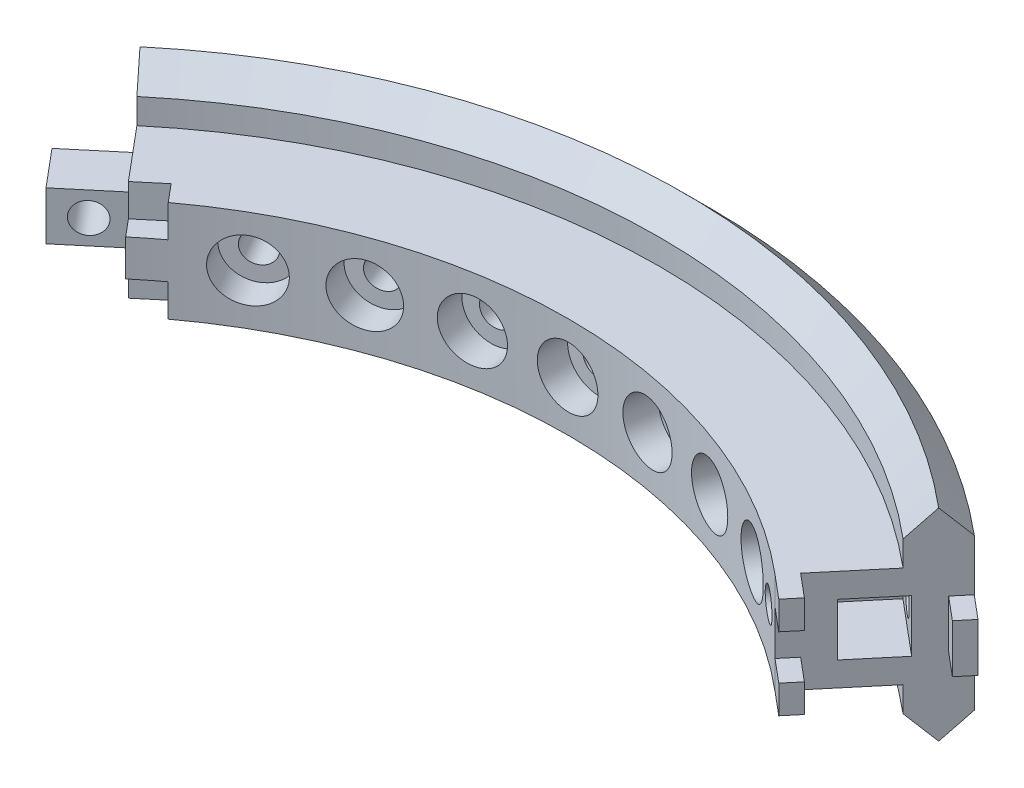
from build123d import *

# Parameters (mm, degrees)
REVOLVE_1_ANGLE          = 80
SKETCH_3_W               = 5.2
SKETCH_3_H               = 5.2
CUT_EXTRUDE_1_DEPTH      = 7
SKETCH_4_W               = 4.8
SKETCH_4_H               = 4.8
EXTRUDE_1_DEPTH          = 6
CUT_EXTRUDE_2_DEPTH      = 82.503774865
CUT_EXTRUDE_2_DEPTH_BACK = 82.503774865
SKETCH_5_R               = 1.5
CUT_EXTRUDE_START        = -1
SKETCH_6_R               = 3
CUT_EXTRUDE_3_DEPTH      = 83.736226881
SKETCH_7_R               = 1.5
CUT_EXTRUDE_4_DEPTH      = 83.059725381
SKETCH_11_R              = 1.5
CUT_EXTRUDE_6_DEPTH      = 52.064095038
CUT_EXTRUDE_7_DEPTH      = 5
SKETCH_13_W              = 3
SKETCH_13_H              = 3
PATTERN_CIRCULAR_1_COUNT = 4
PATTERN_CIRCULAR_1_ANGLE = 30
F_1_THE_OTHER_WAY_COUNT  = 4
F_1_THE_OTHER_WAY_ANGLE  = 30
SKETCH_9_W               = 1.8
SKETCH_9_H               = 4.8
SKETCH_9_H_2             = 2.8
EXTRUDE_2_DEPTH          = 3
SKETCH_10_W              = 2.2
SKETCH_10_H              = 5.2
CUT_EXTRUDE_5_DEPTH      = 3


# Read off the part's stored shape, not the designer's step: 旋转1
with BuildPart() as part:
    # 旋转1 outline → 旋转1 (revolve)
    with BuildSketch(Plane(origin=(0, 0, 0), x_dir=(0.6427876096865408, 0, -0.7660444431189768), z_dir=(0.7660444431189768, 0, 0.6427876096865408))):
        Polygon((59, 5), (50, 5), (50, -5), (59, -5), (59, -7.5), (61.5, -10), (64, -7.5), (64, 7.5), (61.5, 10), (59, 7.5), align=None)
    revolve(axis=Axis((0, 0, 0), (0, 1, 0)), revolution_arc=REVOLVE_1_ANGLE)

    # 草图3 → 切除-拉伸1 (cut)
    with BuildSketch(Plane(origin=(0, 0, 0), x_dir=(0.6427876096865405, 0, -0.766044443118977), z_dir=(0.7660444431189771, 0, 0.6427876096865406))):
        with Locations((57, 0)):
            Rectangle(SKETCH_3_W, SKETCH_3_H)
    extrude(amount=-CUT_EXTRUDE_1_DEPTH, mode=Mode.SUBTRACT)

    # 草图4 → 凸台-拉伸1 (add)
    with BuildSketch(Plane(origin=(0, 0, 0), x_dir=(0.6427876096865351, 0, 0.7660444431189817), z_dir=(-0.7660444431189817, 0, 0.6427876096865351))):
        with Locations((-57, 0)):
            Rectangle(SKETCH_4_W, SKETCH_4_H)
    extrude(amount=EXTRUDE_1_DEPTH)

    # 草图5 → 切除-拉伸2 (cut, two sides: drawn at the far end of the back side and taken through both)
    with BuildSketch(Plane(origin=(34.967645967, 0, -41.672817706), x_dir=(-0.7660444431189772, 0, -0.6427876096865404), z_dir=(0.6427876096865404, 0, -0.7660444431189772)).offset(-CUT_EXTRUDE_2_DEPTH_BACK)):
        with Locations((3.5, 0)):
            Circle(SKETCH_5_R)
    extrude(amount=CUT_EXTRUDE_2_DEPTH + CUT_EXTRUDE_2_DEPTH_BACK, mode=Mode.SUBTRACT)

    # 草图6 → 切除-拉伸3 (cut, through all)
    with BuildSketch(Plane(origin=(38.310141537, 0, -45.65624881), x_dir=(0.7660444431189772, 0, 0.6427876096865404), z_dir=(-0.6427876096865404, 0, 0.7660444431189772)).offset(CUT_EXTRUDE_START)):
        with Locations((-3.5, 0)):
            Circle(SKETCH_6_R)
    extrude(amount=-CUT_EXTRUDE_3_DEPTH, mode=Mode.SUBTRACT)

    # 草图7 → 切除-拉伸4 (cut, through all)
    with BuildSketch(Plane(origin=(-38.181584015, 0, -45.503039921), x_dir=(-0.7660444431189816, 0, 0.6427876096865353), z_dir=(-0.6427876096865353, 0, -0.7660444431189816))):
        with Locations((3, 0)):
            Circle(SKETCH_7_R)
    extrude(amount=-CUT_EXTRUDE_4_DEPTH, mode=Mode.SUBTRACT)

    # 草图11 → 切除-拉伸6 (cut, through all)
    with BuildSketch(Plane(origin=(0, 0, -64), x_dir=(-1, 0, 0), z_dir=(0, 0, -1))):
        Circle(SKETCH_11_R)
    cut_extrude_6 = extrude(amount=-CUT_EXTRUDE_6_DEPTH, mode=Mode.SUBTRACT)

    # 草图12 → 切除-拉伸7 (cut)
    with BuildSketch(Plane(origin=(0, 0, -64), x_dir=(-1, 0, 0), z_dir=(0, 0, -1))):
        Polygon((0, -3.175426481), (2.75, -1.58771324), (2.75, 1.58771324), (0, 3.175426481), (-2.75, 1.58771324), (-2.75, -1.58771324), align=None)
    cut_extrude_7 = extrude(amount=-CUT_EXTRUDE_7_DEPTH, mode=Mode.SUBTRACT)

    # 草图13 → 切除-旋转1 (revolve, cut)
    with BuildSketch(Plane(origin=(0, 0, 0), x_dir=(1, 0, 0), z_dir=(0, 1, 0)), mode=Mode.PRIVATE) as cut_revolve_1_sk:
        with Locations((1.5, 51.409918854)):
            Rectangle(SKETCH_13_W, SKETCH_13_H)
    cut_revolve_1 = revolve(cut_revolve_1_sk.sketch.rotate(Axis((0, 0, 1000), (0, 0, -1)), 180), axis=Axis((0, 0, 1000), (0, 0, -1)), mode=Mode.SUBTRACT)

    # 阵列(圆周)1: 切除-拉伸6, 切除-拉伸7, 切除-旋转1 ×4 about axis
    pattern_circular_1_axis = Axis((0, 0, 0), (0, -1, 0))
    add([cut_extrude_6.rotate(pattern_circular_1_axis, i * PATTERN_CIRCULAR_1_ANGLE / (PATTERN_CIRCULAR_1_COUNT - 1)) for i in range(1, PATTERN_CIRCULAR_1_COUNT)], mode=Mode.SUBTRACT)
    add([cut_extrude_7.rotate(pattern_circular_1_axis, i * PATTERN_CIRCULAR_1_ANGLE / (PATTERN_CIRCULAR_1_COUNT - 1)) for i in range(1, PATTERN_CIRCULAR_1_COUNT)], mode=Mode.SUBTRACT)
    add([cut_revolve_1.rotate(pattern_circular_1_axis, i * PATTERN_CIRCULAR_1_ANGLE / (PATTERN_CIRCULAR_1_COUNT - 1)) for i in range(1, PATTERN_CIRCULAR_1_COUNT)], mode=Mode.SUBTRACT)

    # 1 the other way: 切除-拉伸6, 切除-拉伸7, 切除-旋转1 ×4 about axis
    f_1_the_other_way_axis = Axis((0, 0, 0), (0, 1, 0))
    add([cut_extrude_6.rotate(f_1_the_other_way_axis, i * F_1_THE_OTHER_WAY_ANGLE / (F_1_THE_OTHER_WAY_COUNT - 1)) for i in range(1, F_1_THE_OTHER_WAY_COUNT)], mode=Mode.SUBTRACT)
    add([cut_extrude_7.rotate(f_1_the_other_way_axis, i * F_1_THE_OTHER_WAY_ANGLE / (F_1_THE_OTHER_WAY_COUNT - 1)) for i in range(1, F_1_THE_OTHER_WAY_COUNT)], mode=Mode.SUBTRACT)
    add([cut_revolve_1.rotate(f_1_the_other_way_axis, i * F_1_THE_OTHER_WAY_ANGLE / (F_1_THE_OTHER_WAY_COUNT - 1)) for i in range(1, F_1_THE_OTHER_WAY_COUNT)], mode=Mode.SUBTRACT)

    # 草图9 → 凸台-拉伸2 (add)
    with BuildSketch(Plane(origin=(0, 0, 0), x_dir=(0.6427876096865405, 0, -0.7660444431189771), z_dir=(0.7660444431189771, 0, 0.6427876096865405))):
        with Locations((63.1, 0)):
            Rectangle(SKETCH_9_W, SKETCH_9_H)
        with Locations((50.9, 3.6)):
            Rectangle(SKETCH_9_W, SKETCH_9_H_2)
        with Locations((50.9, -3.6)):
            Rectangle(SKETCH_9_W, SKETCH_9_H_2)
    extrude(amount=EXTRUDE_2_DEPTH)

    # 草图10 → 切除-拉伸5 (cut)
    with BuildSketch(Plane(origin=(0, 0, 0), x_dir=(0.6427876096865351, 0, 0.7660444431189817), z_dir=(-0.7660444431189817, 0, 0.6427876096865351))):
        with Locations((-62.9, 0)):
            Rectangle(SKETCH_10_W, SKETCH_10_H)
        Polygon((-52.2, 5), (-50, 5), (-48, 5), (-48, 1.8), (-50, 1.8), (-52.2, 1.8), align=None)
        Polygon((-52.2, -1.8), (-50, -1.8), (-48, -1.8), (-48, -5), (-50, -5), (-52.2, -5), align=None)
    extrude(amount=-CUT_EXTRUDE_5_DEPTH, mode=Mode.SUBTRACT)


solid = part.part
